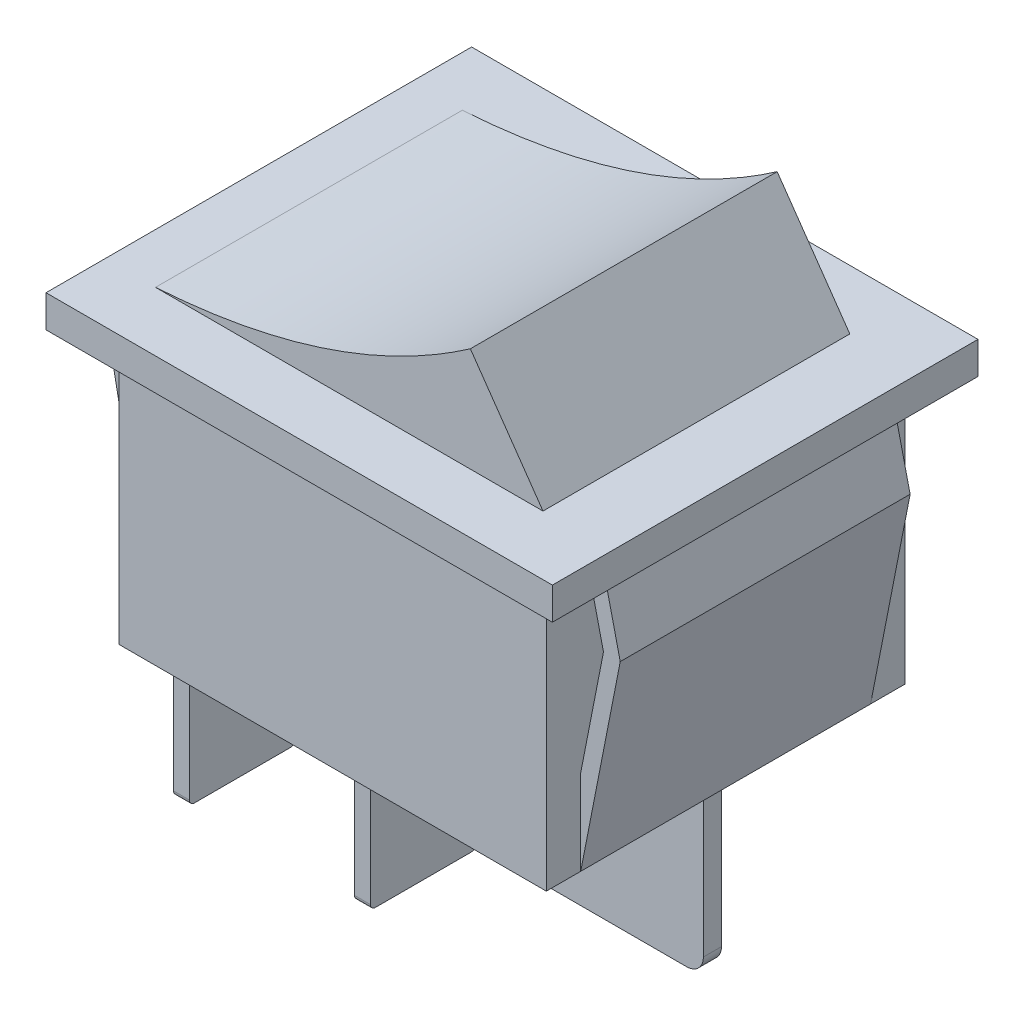
from build123d import *

# Parameters (mm, degrees)
BOSS_EXTRUDE1_DEPTH = 10.7
SKETCH2_3_W         = 2.36
SKETCH2_3_H         = 1.92
BOSS_EXTRUDE2_DEPTH = 12.7
EXTRUDE_THIN1_START = -9.155
EXTRUDE_THIN1_DEPTH = 18.31
SKETCH5_W           = 23.92
SKETCH5_H           = 0.54
BOSS_EXTRUDE3_DEPTH = 9.88
CUT_EXTRUDE1_DEPTH  = 2
BOSS_EXTRUDE4_DEPTH = 8.7
CUT_EXTRUDE3_DEPTH  = 18.7
BOSS_EXTRUDE5_DEPTH = 8.65
BOSS_EXTRUDE7_DEPTH = 8.65


# Read off the part's stored shape, not the designer's step: Extrude-Thin1
with BuildPart() as part:
    # Sketch2 → Boss-Extrude1 (new, symmetric)
    with BuildSketch(Plane.XY):
        Polygon((12.75, -3.906779661), (12.75, 7.08), (5.116131156, 7.08), (-12.75, 7.08), (-12.75, -3.906779661), (-12.75, -9), (0, -9), (12.75, -9), align=None)
    extrude(amount=BOSS_EXTRUDE1_DEPTH, both=True)

    # Sketch2<3> → Boss-Extrude2 (add, symmetric)
    with BuildSketch(Plane.XY):
        Polygon((-12.75, 7.08), (5.116131156, 7.08), (5.116131156, 9), (0, 9), (-12.12, 9), (-12.75, 9), align=None)
        with Locations((-13.93, 8.04)):
            Rectangle(SKETCH2_3_W, SKETCH2_3_H)
        with Locations((13.93, 8.04)):
            Rectangle(SKETCH2_3_W, SKETCH2_3_H)
        Polygon((5.116131156, 7.08), (12.75, 7.08), (12.75, 9), (12.12, 9), (6.67, 9), (5.116131156, 9), align=None)
    extrude(amount=BOSS_EXTRUDE2_DEPTH, both=True)

    # Extrude-Thin1 outline → Extrude-Thin1 (add)
    with BuildSketch(Plane.XY.offset(EXTRUDE_THIN1_START)):
        with BuildLine():
            add(Edge.make_bspline(
                [(-12.12, 9), (-1.256881612, 9.695668212), (6.67, 15.22)],
                knots=[0, 0, 0, 1, 1, 1], degree=2))
            Line((-12.12, 9), (11.004787045, 9))
            Line((11.004787045, 9), (6.67, 15.22))
        make_face()
    extrude(amount=EXTRUDE_THIN1_DEPTH)

    # Sketch5 → Boss-Extrude3 (add)
    with BuildSketch(Plane.XZ.offset(9)):
        with Locations((0, -0.27)):
            Rectangle(SKETCH5_W, SKETCH5_H)
        with Locations((0, 0.27)):
            Rectangle(SKETCH5_W, SKETCH5_H)
    extrude(amount=BOSS_EXTRUDE3_DEPTH)

    # Sketch6 → Cut-Extrude1 (cut)
    with BuildSketch(Plane(origin=(0, 0, -0.54), x_dir=(-1, 0, 0), z_dir=(0, 0, -1))):
        with BuildLine():
            ThreePointArc((-10.96, -18.88), (-11.667106781, -18.587106781), (-11.96, -17.88))
            Line((-11.96, -17.88), (-11.96, -18.88))
            Line((-11.96, -18.88), (-10.96, -18.88))
        make_face()
        with BuildLine():
            Line((11.96, -18.88), (11.96, -17.88))
            ThreePointArc((11.96, -17.88), (11.667106781, -18.587106781), (10.96, -18.88))
            Line((10.96, -18.88), (11.96, -18.88))
        make_face()
    extrude(amount=-CUT_EXTRUDE1_DEPTH, mode=Mode.SUBTRACT)

    # Sketch7 → Boss-Extrude4 (add)
    with BuildSketch(Plane.XZ.offset(9)):
        Polygon((-11.96, 9.64), (-11.96, 0.54), (-11.01, 0.54), (-11.01, 3.822076599), (-11.01, 9.64), align=None)
        Polygon((-1.16, 3.822076599), (-1.16, 0.54), (-0.21, 0.54), (-0.21, 9.64), (-1.16, 9.64), align=None)
        Polygon((-0.21, -0.54), (-1.16, -0.54), (-1.16, -5.923650712), (-1.16, -9.64), (-0.21, -9.64), align=None)
        Polygon((-11.01, -0.54), (-11.96, -0.54), (-11.96, -9.64), (-11.01, -9.64), (-11.01, -5.923650712), align=None)
    extrude(amount=BOSS_EXTRUDE4_DEPTH)

    # Sketch8 → Cut-Extrude3 (cut)
    with BuildSketch(Plane.ZY.offset(11.96)):
        with BuildLine():
            Line((-8.24, -9), (-9.64, -9))
            Line((-9.64, -9), (-9.64, -17.7))
            Line((-9.64, -17.7), (-7.94, -17.7))
            ThreePointArc((-7.94, -17.7), (-8.152132034, -17.612132034), (-8.24, -17.4))
            Line((-8.24, -17.4), (-8.24, -9))
        make_face()
        with BuildLine():
            Line((-0.54, -9), (-1.94, -9))
            Line((-1.94, -9), (-1.94, -17.4))
            ThreePointArc((-1.94, -17.4), (-2.027867966, -17.612132034), (-2.24, -17.7))
            Line((-2.24, -17.7), (-0.54, -17.7))
            Line((-0.54, -17.7), (-0.54, -9))
        make_face()
        with BuildLine():
            ThreePointArc((-4.33865298, -13.35), (-5.09, -12.59865298), (-5.84134702, -13.35))
            Line((-5.84134702, -13.35), (-5.231421356, -13.959925664))
            ThreePointArc((-5.231421356, -13.959925664), (-5.09, -14.018504308), (-4.948578644, -13.959925664))
            Line((-4.948578644, -13.959925664), (-4.33865298, -13.35))
        make_face()
        with BuildLine():
            Line((1.94, -9), (0.54, -9))
            Line((0.54, -9), (0.54, -17.7))
            Line((0.54, -17.7), (2.24, -17.7))
            ThreePointArc((2.24, -17.7), (2.027867966, -17.612132034), (1.94, -17.4))
            Line((1.94, -17.4), (1.94, -9))
        make_face()
        with BuildLine():
            Line((9.64, -9), (8.24, -9))
            Line((8.24, -9), (8.24, -17.4))
            ThreePointArc((8.24, -17.4), (8.152132034, -17.612132034), (7.94, -17.7))
            Line((7.94, -17.7), (9.64, -17.7))
            Line((9.64, -17.7), (9.64, -9))
        make_face()
        with BuildLine():
            ThreePointArc((5.84134702, -13.35), (5.09, -12.59865298), (4.33865298, -13.35))
            Line((4.33865298, -13.35), (4.948578644, -13.959925664))
            ThreePointArc((4.948578644, -13.959925664), (5.09, -14.018504308), (5.231421356, -13.959925664))
            Line((5.231421356, -13.959925664), (5.84134702, -13.35))
        make_face()
    extrude(amount=-CUT_EXTRUDE3_DEPTH, mode=Mode.SUBTRACT)

    # Sketch2<13> → Boss-Extrude5 (add, symmetric)
    with BuildSketch(Plane.XY):
        Polygon((14.248489171, 6.709143574), (15.11, 3.02), (12.75, -9), (12.75, -3.906779661), (14.11, 3.02), (13.248489171, 6.709143574), align=None)
    extrude(amount=BOSS_EXTRUDE5_DEPTH, both=True)

    # Sketch2<16> → Boss-Extrude7 (add, symmetric)
    with BuildSketch(Plane.XY):
        Polygon((-12.75, -3.906779661), (-12.75, -9), (-15.11, 3.02), (-14.248489171, 6.709143574), (-13.248489171, 6.709143574), (-14.11, 3.02), align=None)
    extrude(amount=BOSS_EXTRUDE7_DEPTH, both=True)


solid = part.part
